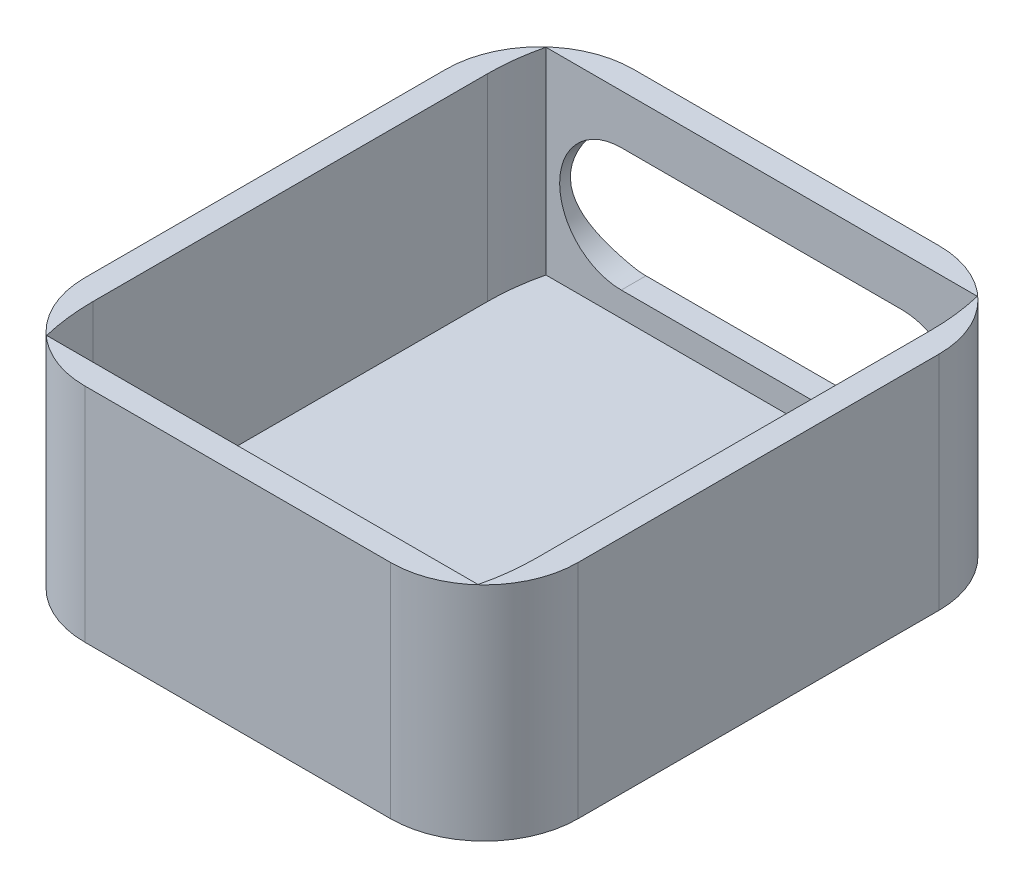
from build123d import *

# Parameters (mm, degrees)
BOSS_EXTRUDE1_DEPTH = 114.3
SHELL1_T            = -12.7
CUT_EXTRUDE1_DEPTH  = 222.690489912
FILLET1_R           = 48.26
FILLET2_R           = 48.26


with BuildPart() as part:
    # Sketch2 → Boss-Extrude1 (new body)
    with BuildSketch(Plane(origin=(0, 0, 0), x_dir=(1, 0, 0), z_dir=(0, 1, 0))):
        with BuildLine():
            Line((-127, 101.6), (-127, -101.6))
            ThreePointArc((-127, -101.6), (-125.402452129, -121.680463142), (-120.65, -141.25573729))
            Line((-120.65, -141.25573729), (120.65, -141.25573729))
            ThreePointArc((120.65, -141.25573729), (125.402452129, -121.680463142), (127, -101.6))
            Line((127, -101.6), (127, 101.6))
            ThreePointArc((127, 101.6), (125.402452129, 121.680463142), (120.65, 141.25573729))
            Line((120.65, 141.25573729), (-120.65, 141.25573729))
            ThreePointArc((-120.65, 141.25573729), (-125.402452129, 121.680463142), (-127, 101.6))
        make_face()
    extrude(amount=BOSS_EXTRUDE1_DEPTH)

    # Shell1
    shell1_openings = [part.faces().sort_by_distance(p)[0] for p in [
        (0, 114.3, 0),
    ]]
    offset(amount=SHELL1_T, openings=shell1_openings, kind=Kind.INTERSECTION)

    # Sketch3 → Cut-Extrude1 (cut, through all)
    # profile 1 of 2: a face of its own
    with BuildSketch(Plane.XY):
        with BuildLine():
            Line((-72.268980264, 88.9), (72.268980264, 88.9))
            ThreePointArc((72.268980264, 88.9), (104.018980264, 57.15), (72.268980264, 25.4))
            Line((72.268980264, 25.4), (-72.268980264, 25.4))
            ThreePointArc((-72.268980264, 25.4), (-104.018980264, 57.15), (-72.268980264, 88.9))
        make_face()
        with BuildLine():
            ThreePointArc((72.268980264, 31.75), (97.668980264, 57.15), (72.268980264, 82.55))
            Line((72.268980264, 82.55), (-72.268980264, 82.55))
            ThreePointArc((-72.268980264, 82.55), (-97.668980264, 57.15), (-72.268980264, 31.75))
            Line((-72.268980264, 31.75), (72.268980264, 31.75))
        make_face(mode=Mode.SUBTRACT)
    # profile 2 of 2: a face of its own
    with BuildSketch(Plane.XY):
        with BuildLine():
            Line((-72.268980264, 31.75), (72.268980264, 31.75))
            ThreePointArc((72.268980264, 31.75), (97.668980264, 57.15), (72.268980264, 82.55))
            Line((72.268980264, 82.55), (-72.268980264, 82.55))
            ThreePointArc((-72.268980264, 82.55), (-97.668980264, 57.15), (-72.268980264, 31.75))
        make_face()
    extrude(amount=-CUT_EXTRUDE1_DEPTH, mode=Mode.SUBTRACT)

    # Fillet1
    fillet1_edges = [part.edges().sort_by_distance(p)[0] for p in [
        (120.65, 57.15, 141.25573729),
        (-120.65, 57.15, 141.25573729),
    ]]
    fillet(fillet1_edges, radius=FILLET1_R)

    # Fillet2
    # the kernel refuses this fillet: 48.26 mm, written as the material it takes off along each edge
    with BuildSketch(Plane(origin=(-120.65, -121.689926144, -141.25573729), x_dir=(-0.13045451257138782, 0, 0.9914542955425437), z_dir=(0, 1, 0))) as fillet2_piece_1:
        with BuildLine():
            CenterArc((42.380235681, 47.847584303), FILLET2_R, 187.49585764, 90)
            Line((-5.467348622, 41.551849526), (-10.252107052, 40.922276049))
            Line((-10.252107052, 40.922276049), (-4.78475843, -0.629573478))
            Line((-4.78475843, -0.629573478), (-0.895945537, -4.742104764))
            ThreePointArc((-0.895945537, -4.742104764), (40.774810711, -5.907223328), (49.305543935, -4.78475843))
            Line((49.305543935, -4.78475843), (48.675970458, 0))
        make_face()
    extrude(amount=357.679852289, mode=Mode.SUBTRACT)
    with BuildSketch(Plane(origin=(120.65, -121.689926144, -141.25573729), x_dir=(-1, 0, 0), z_dir=(0, 1, 0))) as fillet2_piece_2:
        with BuildLine():
            CenterArc((41.91, 48.26), FILLET2_R, 180, 90)
            Line((-6.35, 48.26), (-11.176, 48.26))
            ThreePointArc((-11.176, 48.26), (-11.176, 39.65573729), (-4.5847, -1.506918017))
            Line((-4.5847, -1.506918017), (0, -4.826))
            Line((0, -4.826), (41.91, -4.826))
            Line((41.91, -4.826), (41.91, 0))
        make_face()
    extrude(amount=357.679852289, mode=Mode.SUBTRACT)


solid = part.part
